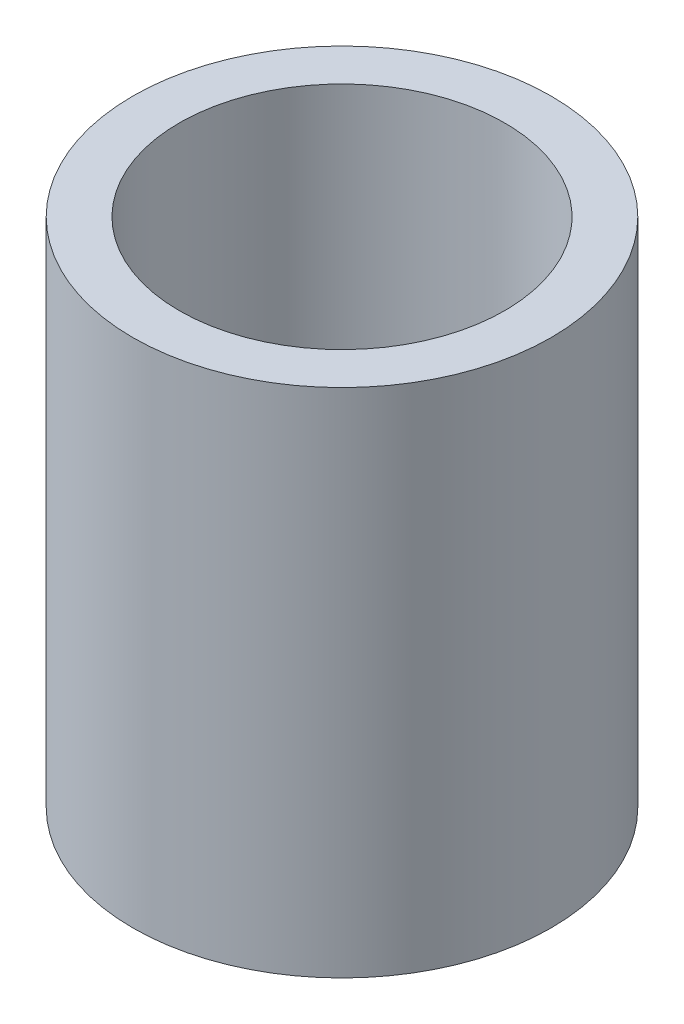
from build123d import *

# Parameters (mm, degrees)
BOSS_EXTRUDE1_DEPTH = 70
BOSS_EXTRUDE2_DEPTH = 10
CUT_EXTRUDE1_START  = -70
CUT_EXTRUDE1_DEPTH  = 70


with BuildPart() as part:
    # Sketch1 → Revolve1 (revolve)
    with BuildSketch(Plane(origin=(0, 0, 0), x_dir=(0, 0, -1), z_dir=(1, 0, 0))):
        Polygon((25, -10.461538461543608), (35, -10.461538461543604), (34.999999999999986, 89.53846153845629), (44.999999999999986, 89.53846153845639), (45.00000000000003, -20.461538461543608), (2.22e-15, -20.461538461543622), (0, -10.461538461543615), (-6.07e-15, 49.53846153845638), (7.999999999999995, 49.53846153845638), align=None)
    revolve(axis=Axis((0, 0, 0), (0, -1, 0)))

    # Sketch2 → Boss-Extrude1 (add)
    with BuildSketch(Plane.XZ.offset(20.461538461543615)):
        with BuildLine():
            Line((40, 5.465154107020386), (5.531957915011424, 5.064330323600787))
            ThreePointArc((5.531957915011425, 5.064330323600787), (6.990696830881228, 2.7166445882203942), (7.5, 0))
            ThreePointArc((7.5, -1.84e-15), (7.0062926922203665, -2.676165673298177), (5.590169943749472, -5.000000000000002))
            Line((5.590169943749473, -5), (40, -5))
            Line((40, -4.999999999999999), (40, 5.465154107020386))
        make_face()
    extrude(amount=-BOSS_EXTRUDE1_DEPTH)

    # Sketch2<3> → Boss-Extrude2 (add)
    with BuildSketch(Plane.XZ.offset(20.461538461543615)):
        with BuildLine():
            ThreePointArc((7.5, 0), (6.990696830881228, 2.7166445882203942), (5.531957915011425, 5.064330323600787))
            ThreePointArc((5.531957915011425, 5.064330323600787), (-7.499874548437054, -0.04337923127598321), (5.590169943749472, -5.000000000000002))
            ThreePointArc((5.590169943749472, -5.000000000000002), (7.0062926922203665, -2.676165673298177), (7.5, -1.84e-15))
        make_face()
        with BuildLine():
            ThreePointArc((3.1e-16, 5), (3.5355339059327378, 3.5355339059327373), (5, 0))
            ThreePointArc((5, -1.22e-15), (-3.5355339059327386, -3.5355339059327373), (3.1e-16, 5))
        make_face(mode=Mode.SUBTRACT)
    extrude(amount=BOSS_EXTRUDE2_DEPTH)

    # Sketch2<4> → Cut-Extrude1 (cut)
    with BuildSketch(Plane.XZ.offset(20.461538461543615).offset(CUT_EXTRUDE1_START)):
        with BuildLine():
            ThreePointArc((3.1e-16, 5), (-3.5355339059327386, -3.5355339059327373), (5, -1.22e-15))
            ThreePointArc((5, 0), (3.5355339059327378, 3.5355339059327373), (3.1e-16, 5))
        make_face()
    extrude(amount=CUT_EXTRUDE1_DEPTH, mode=Mode.SUBTRACT)


solid = part.part
